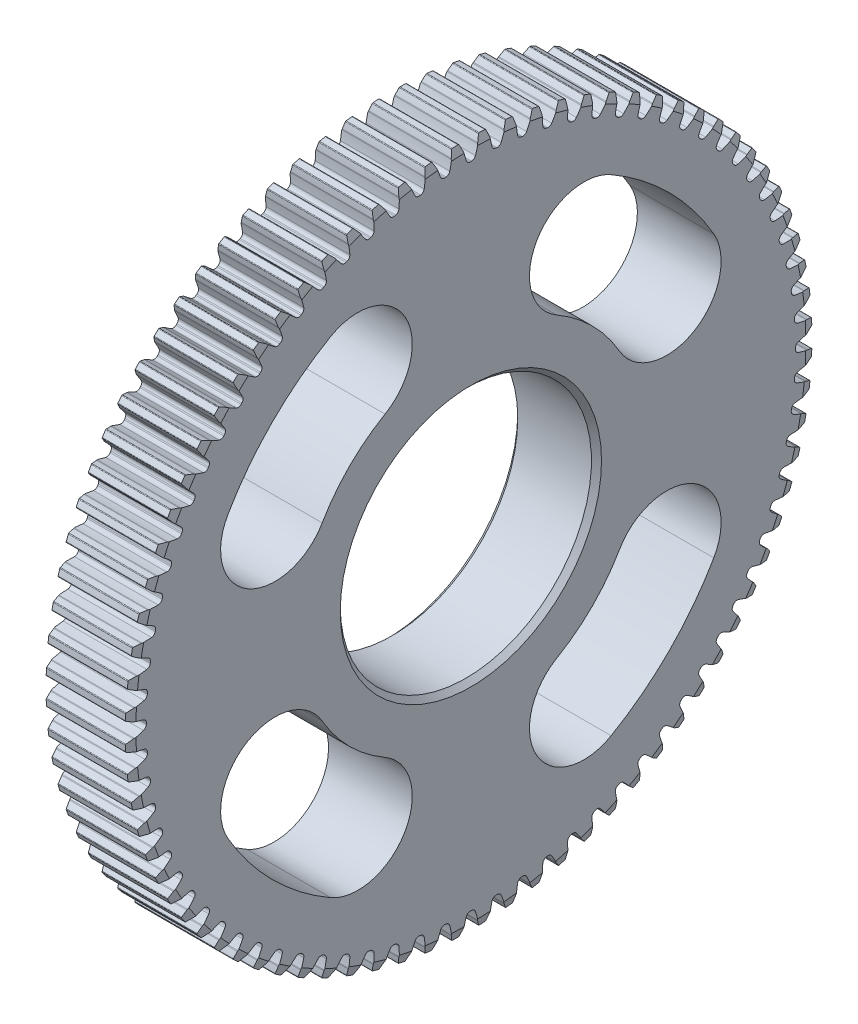
from build123d import *

# Parameters (mm, degrees)
CUT_EXTRUDE1_DEPTH = 30.419381367
CIRPATTERN1_COUNT  = 80
SKETCH4_R          = 7.5
CUT_EXTRUDE2_DEPTH = 30.405900619
CHAMFER3_SIZE      = 0.3
CUT_EXTRUDE5_REACH = 31.406
CIRPATTERN6_COUNT  = 4


with BuildPart() as part:
    # Sketch1 → Revolve1 (revolve)
    with BuildSketch(Plane.XY):
        Polygon((0, 0), (0, 20), (0.133974596, 20.5), (4.866025404, 20.5), (5, 20), (5, 0), align=None)
    revolve(axis=Axis((0, 0, 0), (1, 0, 0)))

    # Sketch2 → Cut-Extrude1 (cut, through all)
    with BuildSketch(Plane(origin=(0, 0, 0), x_dir=(0, 0, -1), z_dir=(1, 0, 0))):
        with BuildLine():
            ThreePointArc((0.035816704, 19.374966895), (0, 19.375), (-0.035816704, 19.374966895))
            ThreePointArc((-0.035816704, 19.374966895), (-0.181862174, 19.421728928), (-0.273131123, 19.544960198))
            ThreePointArc((-0.273131123, 19.544960198), (-0.355032603, 19.806491613), (-0.425208701, 20.071410184))
            ThreePointArc((-0.425208701, 20.071410184), (-0.431720175, 20.094966666), (-0.439771306, 20.118042333))
            ThreePointArc((-0.439771306, 20.118042333), (-0.509174568, 20.290481409), (-0.583358378, 20.460918523))
            ThreePointArc((-0.583358378, 20.460918523), (-0.602455877, 20.482748236), (-0.630458998, 20.490303108))
            ThreePointArc((-0.630458998, 20.490303108), (0, 20.5), (0.630458998, 20.490303108))
            ThreePointArc((0.630458998, 20.490303108), (0.602455877, 20.482748236), (0.583358378, 20.460918523))
            ThreePointArc((0.583358378, 20.460918523), (0.509174568, 20.290481409), (0.439771306, 20.118042333))
            ThreePointArc((0.439771306, 20.118042333), (0.431720175, 20.094966666), (0.425208701, 20.071410184))
            ThreePointArc((0.425208701, 20.071410184), (0.355032603, 19.806491613), (0.273131123, 19.544960198))
            ThreePointArc((0.273131123, 19.544960198), (0.181862174, 19.421728928), (0.035816704, 19.374966895))
        make_face()
    cut_extrude1 = extrude(amount=CUT_EXTRUDE1_DEPTH, mode=Mode.SUBTRACT)

    # CirPattern1: Cut-Extrude1 ×80 about axis
    cirpattern1_axis = Axis((-84.99, 0, 0), (1, 0, 0))
    for i in range(1, CIRPATTERN1_COUNT):
        add(cut_extrude1.rotate(cirpattern1_axis, i * 360 / CIRPATTERN1_COUNT), mode=Mode.SUBTRACT)

    # Sketch4 → Cut-Extrude2 (cut, through all)
    with BuildSketch(Plane.ZY):
        Circle(SKETCH4_R)
    extrude(amount=-CUT_EXTRUDE2_DEPTH, mode=Mode.SUBTRACT)

    # Chamfer3
    chamfer3_edges = [part.edges().sort_by_distance(p)[0] for p in [
        (5, 0, -7.5),
        (0, 0, -7.5),
    ]]
    chamfer(chamfer3_edges, length=CHAMFER3_SIZE)

    # Sketch17 → Cut-Extrude5 (cut, up to next)
    with BuildSketch(Plane.ZY, mode=Mode.PRIVATE) as cut_extrude5_sk1:
        with BuildLine():
            ThreePointArc((-8.375, 14.505925513), (-11.844038585, 11.844038585), (-14.505925513, 8.375))
            ThreePointArc((-14.505925513, 8.375), (-13.316342951, 3.935417438), (-8.876760389, 5.125))
            ThreePointArc((-8.876760389, 5.125), (-7.247844507, 7.247844507), (-5.125, 8.876760389))
            ThreePointArc((-5.125, 8.876760389), (-3.935417438, 13.316342951), (-8.375, 14.505925513))
        make_face()
    cut_extrude5_tool1 = extrude(cut_extrude5_sk1.sketch, amount=-CUT_EXTRUDE5_REACH, mode=Mode.PRIVATE) & part.part
    cut_extrude5 = cut_extrude5_tool1.solids().sort_by_distance((0, 9.346438, -9.346438))[0]
    add(cut_extrude5, mode=Mode.SUBTRACT)

    # CirPattern6: Cut-Extrude5 ×4 about axis
    cirpattern6_axis = Axis((-84.99, 0, 0), (1, 0, 0))
    for i in range(1, CIRPATTERN6_COUNT):
        add(cut_extrude5.rotate(cirpattern6_axis, i * 360 / CIRPATTERN6_COUNT), mode=Mode.SUBTRACT)


solid = part.part
